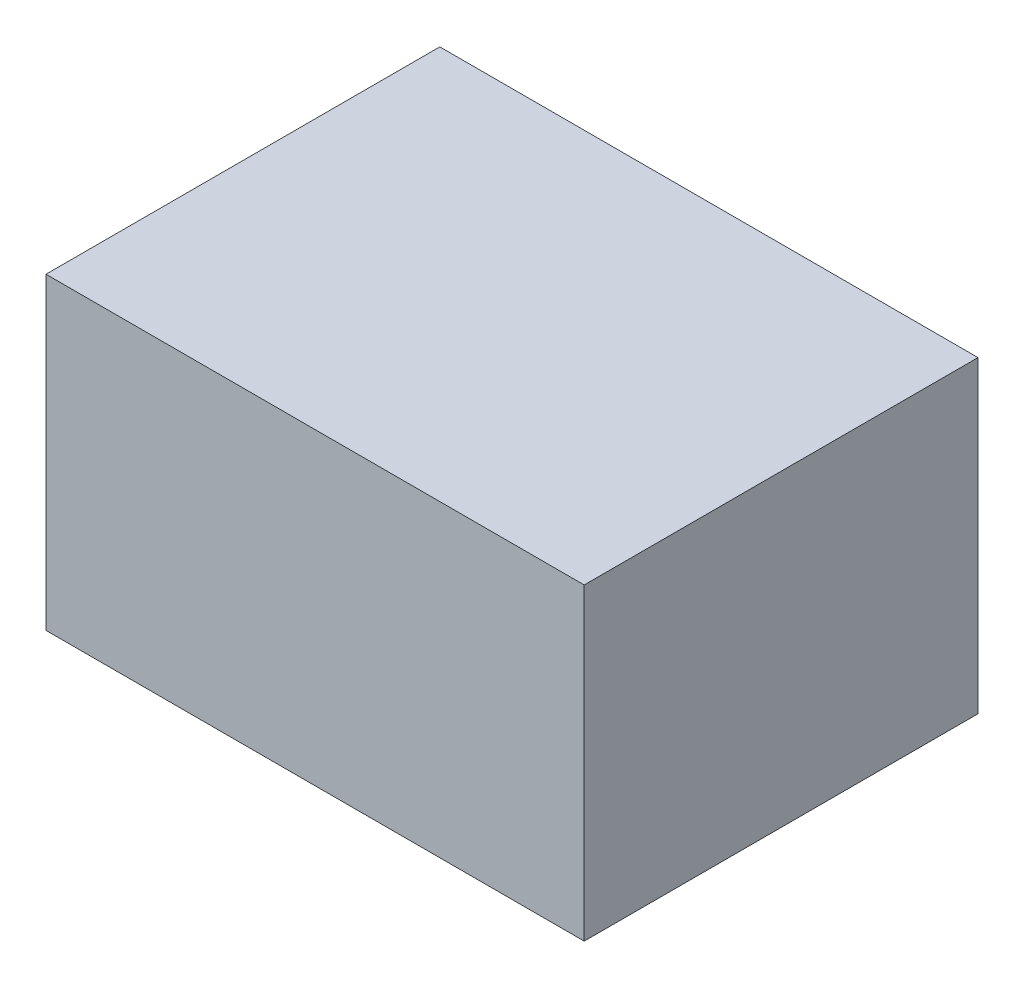
from build123d import *

# Parameters (mm, degrees)
SKETCH1_W      = 104.14
SKETCH1_H      = 59.69
EXTRUDE1_DEPTH = 38.1


with BuildPart() as part:
    # Sketch1 → Extrude1 (new, symmetric)
    with BuildSketch(Plane.XY):
        Rectangle(SKETCH1_W, SKETCH1_H)
    extrude(amount=EXTRUDE1_DEPTH, both=True)


solid = part.part
